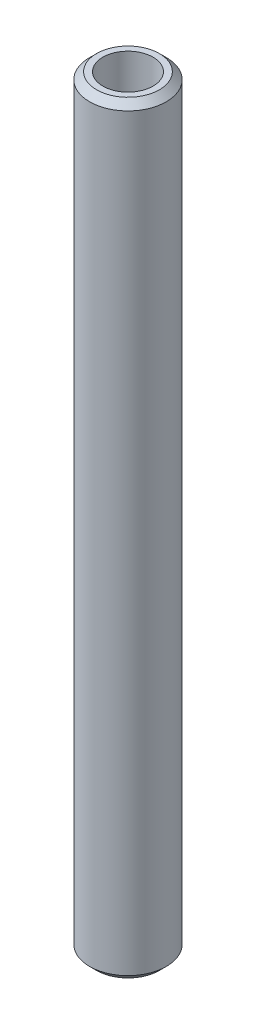
from build123d import *

# Parameters (mm, degrees)
SKETCH1_R           = 10
BOSS_EXTRUDE1_DEPTH = 198.892360066
SKETCH2_R           = 6.549613207
CUT_EXTRUDE1_DEPTH  = 200.394510688
CHAMFER1_SIZE       = 1.809594234


with BuildPart() as part:
    # Sketch1 → Boss-Extrude1 (new body)
    with BuildSketch(Plane(origin=(0, 0, 0), x_dir=(1, 0, 0), z_dir=(0, 1, 0))):
        Circle(SKETCH1_R)
    extrude(amount=BOSS_EXTRUDE1_DEPTH)

    # Sketch2 → Cut-Extrude1 (cut, through all)
    with BuildSketch(Plane(origin=(0, 0, 0), x_dir=(1, 0, 0), z_dir=(0, 1, 0))):
        Circle(SKETCH2_R)
    extrude(amount=CUT_EXTRUDE1_DEPTH, mode=Mode.SUBTRACT)

    # Chamfer1
    chamfer1_edges = [part.edges().sort_by_distance(p)[0] for p in [
        (-10, 198.892360066, 0),
        (-10, 0, 0),
    ]]
    chamfer(chamfer1_edges, length=CHAMFER1_SIZE)


solid = part.part
